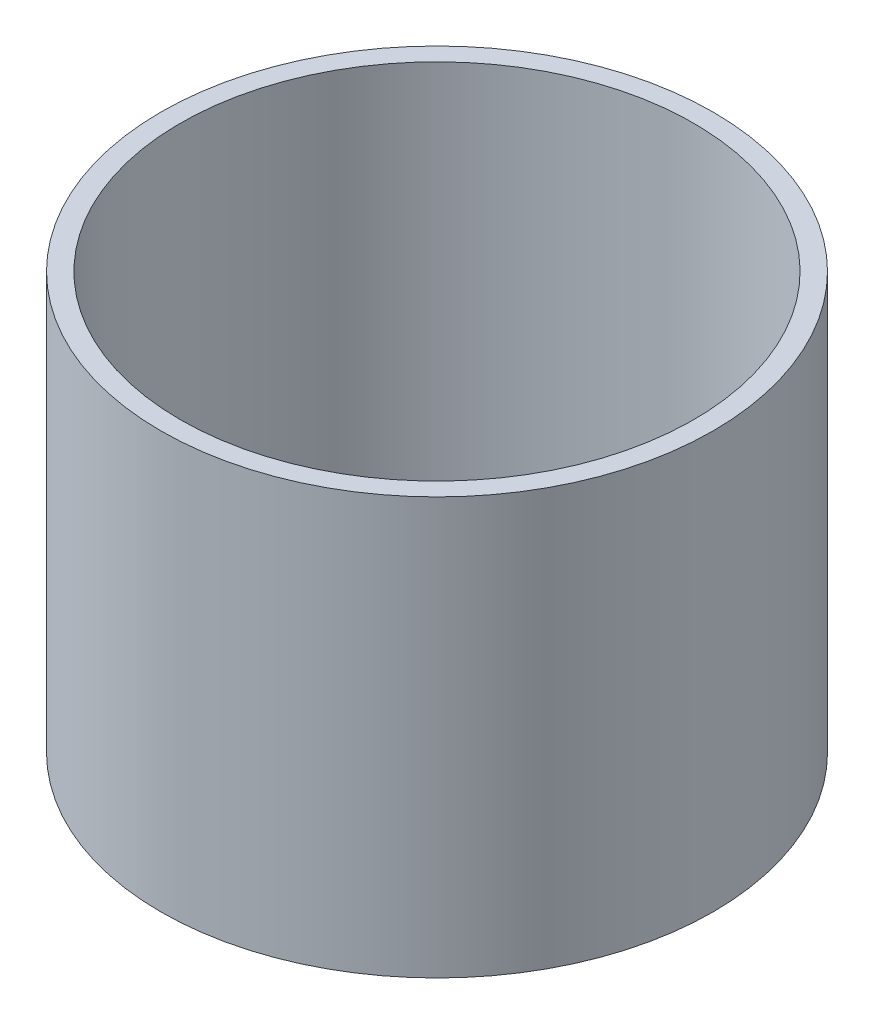
from build123d import *

# Parameters (mm, degrees)
SKETCH1_R           = 72.39
SKETCH1_R_2         = 67.31
BOSS_EXTRUDE1_DEPTH = 104.14
BOSS_EXTRUDE2_START = 5.08
SKETCH2_R           = 72.39
SKETCH2_R_2         = 3.3782
BOSS_EXTRUDE2_DEPTH = 5.08


with BuildPart() as part:
    # Sketch1 → Boss-Extrude1 (new body)
    with BuildSketch(Plane(origin=(0, 0, 0), x_dir=(1, 0, 0), z_dir=(0, 1, 0))):
        Circle(SKETCH1_R)
        Circle(SKETCH1_R_2, mode=Mode.SUBTRACT)
    extrude(amount=BOSS_EXTRUDE1_DEPTH)

    # Sketch2 → Boss-Extrude2 (add)
    with BuildSketch(Plane.XZ.offset(BOSS_EXTRUDE2_START)):
        Circle(SKETCH2_R)
        with Locations((0, 48.26)):
            Circle(SKETCH2_R_2, mode=Mode.SUBTRACT)
        with Locations((48.26, 0)):
            Circle(SKETCH2_R_2, mode=Mode.SUBTRACT)
        with Locations((0, -48.26)):
            Circle(SKETCH2_R_2, mode=Mode.SUBTRACT)
        with Locations((-48.26, 0)):
            Circle(SKETCH2_R_2, mode=Mode.SUBTRACT)
    extrude(amount=-BOSS_EXTRUDE2_DEPTH)


solid = part.part
